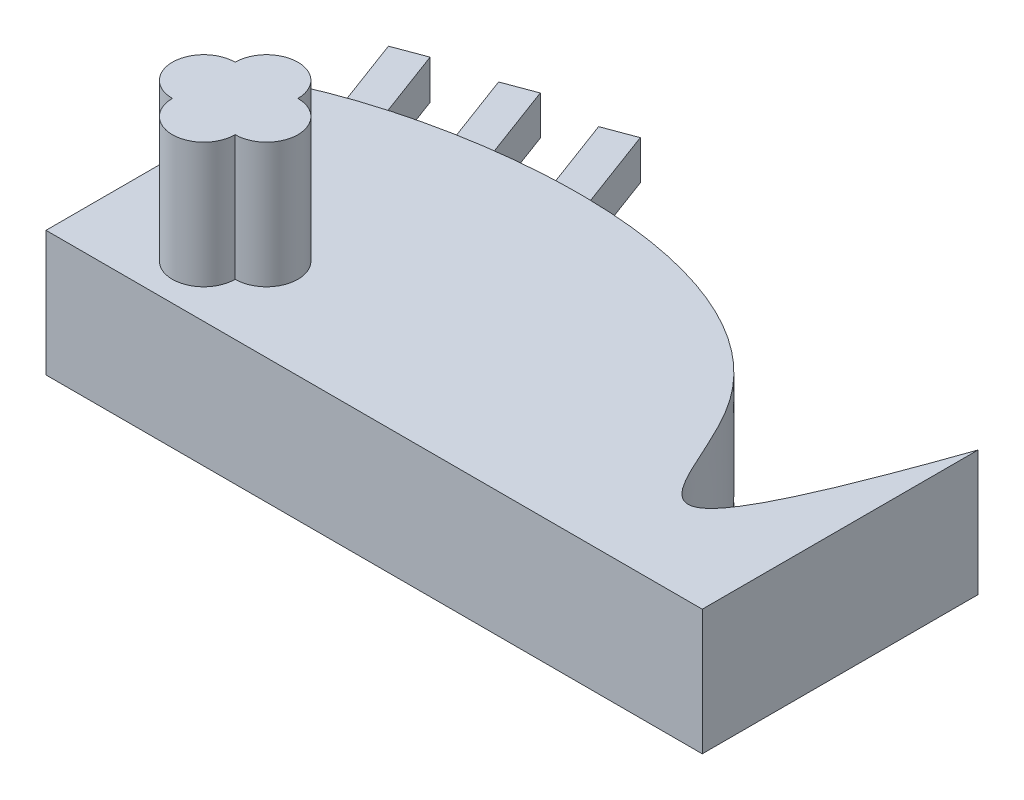
from build123d import *

# Parameters (mm, degrees)
SKETCH1_W               = 220
SKETCH1_H               = 100
BOSS_EXTRUDE1_DEPTH     = 42
CUT_EXTRUDE1_DEPTH      = 128.921851144
CUT_EXTRUDE1_DEPTH_BACK = 42
SKETCH4_W               = 10.863046684
SKETCH4_H               = 13.116347432
BOSS_EXTRUDE2_DEPTH     = 42
CRVPATTERN4_START       = 14.441826284
CRVPATTERN4_DEPTH       = 13.116347432
SKETCH5_R               = 10.522438617
BOSS_EXTRUDE3_DEPTH     = 42
CRVPATTERN5_START       = 42
CRVPATTERN5_DEPTH       = 42


# Read off the part's stored shape, not the designer's step: CrvPattern4, CrvPattern5
with BuildPart() as part:
    # Sketch1 → Boss-Extrude1 (new body)
    with BuildSketch(Plane(origin=(0, 0, 0), x_dir=(1, 0, 0), z_dir=(0, 1, 0))):
        Rectangle(SKETCH1_W, SKETCH1_H)
    extrude(amount=BOSS_EXTRUDE1_DEPTH)

    # Sketch2 → Cut-Extrude1 (cut, two sides: drawn at the far end of the back side and taken through both)
    with BuildSketch(Plane(origin=(0, 42, 0), x_dir=(1, 0, 0), z_dir=(0, 1, 0)).offset(-CUT_EXTRUDE1_DEPTH_BACK)):
        with BuildLine():
            Line((-110, 50), (-110, 34.018302373))
            add(Edge.make_bspline(
                [(-110, 34.018302373), (-90.921302279, 42.796993449), (-62.347364364, 49.638009449), (-33.667598225, 50)],
                knots=[0, 0, 0, 0, 0.288325929, 0.288325929, 0.288325929, 0.288325929], degree=3))
            Line((-33.667598225, 50), (-110, 50))
        make_face()
        with BuildLine():
            Line((110, 50), (-28.922259265, 50))
            add(Edge.make_bspline(
                [(-28.922259265, 50), (5.063593541, 49.565322922), (73.051912414, 29.42561028), (73.809802477, -61.258173527), (110, 42.435201929)],
                knots=[0.304230058, 0.304230058, 0.304230058, 0.304230058, 0.646100978, 1, 1, 1, 1], degree=3))
            Line((110, 42.435201929), (110, 50))
        make_face()
    extrude(amount=CUT_EXTRUDE1_DEPTH + CUT_EXTRUDE1_DEPTH_BACK, mode=Mode.SUBTRACT)

    # CrvPattern4 outline → CrvPattern4 (add)
    with BuildSketch(Plane(origin=(0, 0, 0), x_dir=(1, 0, 0), z_dir=(0, 1, 0)).offset(CRVPATTERN4_START)):
        with BuildLine():
            Line((-61.914207467, 87.170095465), (-47.814600775, 49.311928392))
            add(Edge.make_bspline(
                [(-47.814600775, 49.311928392), (-45.937957006, 49.469032429), (-44.054080269, 49.601099301), (-42.165682791, 49.706817193)],
                knots=[0.240747613, 0.240747613, 0.240747613, 0.240747613, 0.259807176, 0.259807176, 0.259807176, 0.259807176], degree=3))
            Line((-42.165682791, 49.706817193), (-37.07570519, 51.602489588))
            Line((-37.07570519, 51.602489588), (-51.734252265, 90.961440256))
            Line((-51.734252265, 90.961440256), (-61.914207467, 87.170095465))
        make_face()
        with BuildLine():
            Line((-66.80866968, 47.79871448), (-81.467216756, 87.157665147))
            Line((-81.467216756, 87.157665147), (-91.647171958, 83.366320357))
            Line((-91.647171958, 83.366320357), (-77.268122044, 44.7578339))
            add(Edge.make_bspline(
                [(-77.268122044, 44.7578339), (-75.500522799, 45.159009867), (-73.709714059, 45.54122177), (-71.898647282, 45.903042085)],
                knots=[0.137413099, 0.137413099, 0.137413099, 0.137413099, 0.157017326, 0.157017326, 0.157017326, 0.157017326], degree=3))
            Line((-71.898647282, 45.903042085), (-66.80866968, 47.79871448))
        make_face()
    extrude(amount=CRVPATTERN4_DEPTH)

    # Sketch5 → Boss-Extrude3 (add)
    with BuildSketch(Plane(origin=(0, 42, 0), x_dir=(1, 0, 0), z_dir=(0, 1, 0))):
        with Locations(Location((-74.582648438, -11.488268504, 0), (0, 0, 90))):
            Circle(SKETCH5_R)
    extrude(amount=BOSS_EXTRUDE3_DEPTH)

    # CrvPattern5 outline → CrvPattern5 (add)
    with BuildSketch(Plane(origin=(0, 0, 0), x_dir=(1, 0, 0), z_dir=(0, 1, 0)).offset(CRVPATTERN5_START)):
        with BuildLine():
            ThreePointArc((-85.105087055, -11.488268504), (-95.627525672, -22.010707121), (-85.105087055, -32.533145738))
            ThreePointArc((-85.105087055, -32.533145738), (-74.582648438, -43.055584355), (-64.060209821, -32.533145738))
            ThreePointArc((-64.060209821, -32.533145738), (-53.537771204, -22.010707121), (-64.060209821, -11.488268504))
            ThreePointArc((-64.060209821, -11.488268504), (-74.582648438, -22.010707121), (-85.105087055, -11.488268504))
        make_face()
    extrude(amount=CRVPATTERN5_DEPTH)


with BuildPart() as body_2:
    # Sketch4 → Boss-Extrude2 (new body)
    with BuildSketch(Plane(origin=(-100.762158874, 21, -37.838685151), x_dir=(-0.9371178730352806, 0, 0.3490130255990909), z_dir=(-0.3490130255990909, 0, -0.9371178730352806))):
        Rectangle(SKETCH4_W, SKETCH4_H)
    extrude(amount=BOSS_EXTRUDE2_DEPTH)


solid = Compound([part.part, body_2.part])
